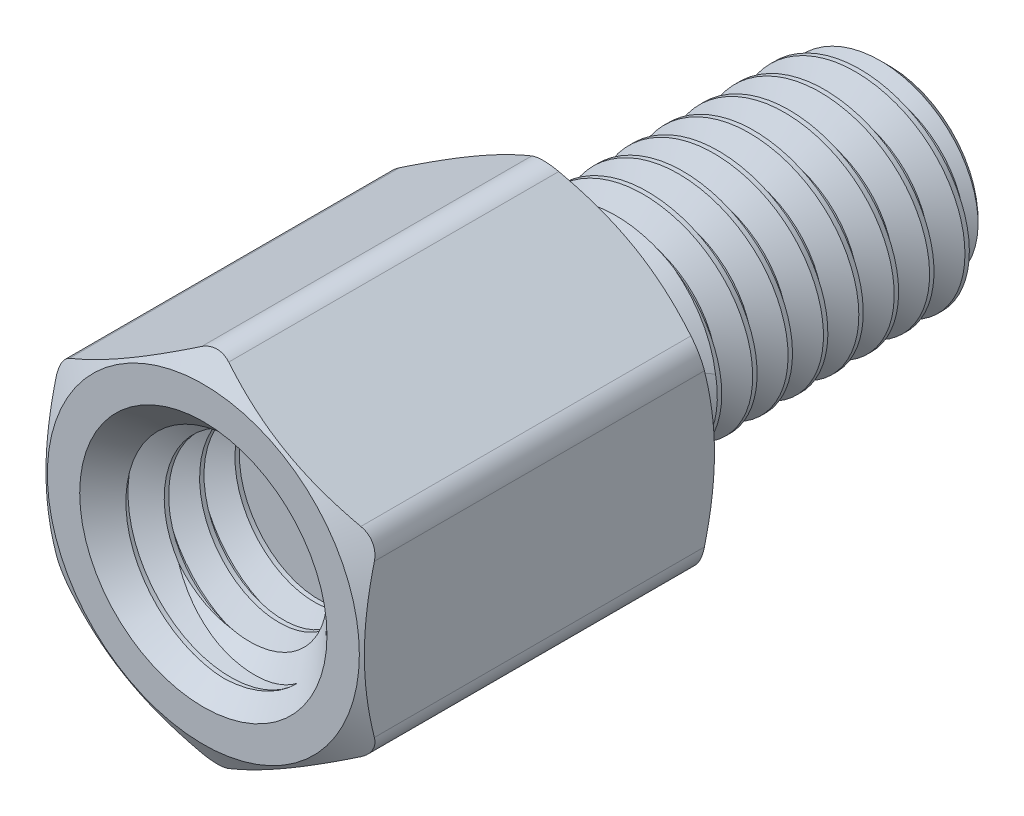
from build123d import *

# Parameters (mm, degrees)
SKETCH4_R           = 1.875
BOSS_EXTRUDE1_DEPTH = 5
SKETCH5_OUTSIDE_W   = 47.99
SKETCH5_OUTSIDE_H   = 48.686
SKETCH5_OUTSIDE_R   = 2.205
CUT_EXTRUDE1_DEPTH  = 11.290894033
CUT_EXTRUDE1_DRAFT  = -60
SKETCH6_OUTSIDE_W   = 33.36
SKETCH6_OUTSIDE_H   = 34.056
SKETCH6_OUTSIDE_R   = 2.205
CUT_EXTRUDE2_DEPTH  = 7.06733055
CUT_EXTRUDE2_DRAFT  = -60
FILLET1_R           = 0.3825
CUT_SWEEP1_PITCH    = 0.5
SKETCH9_R           = 1.75
BOSS_EXTRUDE2_DEPTH = 1.8
SKETCH10_W          = 1.8
SKETCH10_H          = 1.5
CUT_SWEEP2_PITCH    = 0.5


with BuildPart() as part:
    # Sketch3 → Revolve1 (revolve)
    with BuildSketch(Plane(origin=(0, 0, 0), x_dir=(0, 0, -1), z_dir=(1, 0, 0))):
        with BuildLine():
            Line((-3.2, 1.25), (-3.2, 0))
            Line((-3.2, 0), (4.7, 0))
            Line((4.7, 0), (4.7, 1.25))
            Line((4.7, 1.25), (4.45, 1.5))
            Line((4.45, 1.5), (0.7515, 1.5))
            Line((0.7515, 1.5), (0.564, 1.175240474))
            Line((0.564, 1.175240474), (0.25, 1.175240474))
            ThreePointArc((0.25, 1.175240474), (0.073223305, 1.248463778), (0, 1.425240474))
            Line((0, 1.425240474), (0, 2.25))
            Line((0, 2.25), (-5, 2.25))
            Line((-5, 2.25), (-5, 1.75))
            Line((-5, 1.75), (-4.75, 1.5))
            Line((-4.75, 1.5), (-3.45, 1.5))
            Line((-3.45, 1.5), (-3.2, 1.25))
        make_face()
    revolve(axis=Axis((0, 0, -4.7), (0, 0, 1)))

    # Sketch4 → Boss-Extrude1 (add)
    with BuildSketch(Plane.XY.offset(5)):
        Polygon((-2.25, 1.299038106), (-2.25, -1.299038106), (0, -2.598076211), (2.25, -1.299038106), (2.25, 1.299038106), (0, 2.598076211), align=None)
        Circle(SKETCH4_R, mode=Mode.SUBTRACT)
    extrude(amount=-BOSS_EXTRUDE1_DEPTH)


with BuildPart() as cut_extrude1_tool:
    # Sketch5 outside → Cut-Extrude1 (with draft: the straight prism first)
    with BuildSketch(Plane.XY.offset(5)):
        Rectangle(SKETCH5_OUTSIDE_W, SKETCH5_OUTSIDE_H)
        Circle(SKETCH5_OUTSIDE_R, mode=Mode.SUBTRACT)
    extrude(amount=-CUT_EXTRUDE1_DEPTH)
    # Cut-Extrude1: the draft: its side faces are tilted about the plane it starts from
    cut_extrude1_sides = [cut_extrude1_tool.faces().sort_by_distance(p)[0] for p in [
        (0, -24.343, -0.645447017),
        (23.995, 0, -0.645447017),
        (0, 24.343, -0.645447017),
        (-23.995, 0, -0.645447017),
        (-2.205, 0, -0.645447017),
    ]]
    draft(cut_extrude1_sides, Plane.XY.offset(5), CUT_EXTRUDE1_DRAFT)


with BuildPart() as part_1:
    add(part.part)

    # Cut-Extrude1: cut by cut_extrude1_tool
    add(cut_extrude1_tool.part, mode=Mode.SUBTRACT)


with BuildPart() as cut_extrude2_tool:
    # Sketch6 outside → Cut-Extrude2 (with draft: the straight prism first)
    with BuildSketch(Plane(origin=(0, 0, 0), x_dir=(-1, 0, 0), z_dir=(0, 0, -1))):
        Rectangle(SKETCH6_OUTSIDE_W, SKETCH6_OUTSIDE_H)
        Circle(SKETCH6_OUTSIDE_R, mode=Mode.SUBTRACT)
    extrude(amount=-CUT_EXTRUDE2_DEPTH)
    # Cut-Extrude2: the draft: its side faces are tilted about the plane it starts from
    cut_extrude2_sides = [cut_extrude2_tool.faces().sort_by_distance(p)[0] for p in [
        (0, -17.028, 3.533665275),
        (-16.68, 0, 3.533665275),
        (0, 17.028, 3.533665275),
        (16.68, 0, 3.533665275),
        (2.205, 0, 3.533665275),
    ]]
    draft(cut_extrude2_sides, Plane(origin=(0, 0, 0), x_dir=(-1, 0, 0), z_dir=(0, 0, -1)), CUT_EXTRUDE2_DRAFT)


with BuildPart() as part_2:
    add(part_1.part)

    # Cut-Extrude2: cut by cut_extrude2_tool
    add(cut_extrude2_tool.part, mode=Mode.SUBTRACT)

    # Fillet1
    fillet1_edges = [part_2.edges().sort_by_distance(p)[0] for p in [
        (0, 2.598076211, 2.5),
        (-2.25, -1.299038106, 2.5),
        (0, -2.598076211, 2.5),
        (2.25, -1.299038106, 2.5),
        (2.25, 1.299038106, 2.5),
        (-2.25, 1.299038106, 2.5),
    ]]
    fillet(fillet1_edges, radius=FILLET1_R)

    # Cut-Sweep1: the profile of Sketch7 profile screwed along a right-hand helix of 9.118 turns, 6 arcs to a turn; built about Z, then put on its axis
    cut_sweep1_z = Axis((0, 0, 0), (0, 0, 1))
    cut_sweep1_corners = [(1.174940474, 0, -0.187673205), (1.174940474, 0, -0.249826795), (1.527063294, 0, -0.453125), (1.527063294, 0, 0.015625)]
    with BuildLine(mode=Mode.PRIVATE) as cut_sweep1_profile:
        Line(cut_sweep1_corners[0], cut_sweep1_corners[1])
        Line(cut_sweep1_corners[1], cut_sweep1_corners[2])
        Line(cut_sweep1_corners[2], cut_sweep1_corners[3])
        Line(cut_sweep1_corners[3], cut_sweep1_corners[0])
    cut_sweep1_cap = Face(cut_sweep1_profile.wire())
    cut_sweep1_turn_angles = [0, 30, 60, 90, 120, 150, 180, 210, 240, 270, 300, 330, 360]
    cut_sweep1_turn_weights = [1, 0.8660254037844387, 1, 0.8660254037844387, 1, 0.8660254037844387, 1, 0.8660254037844387, 1, 0.8660254037844387, 1, 0.8660254037844387, 1]
    cut_sweep1_turn_rails = [Edge.make_bspline([Vector(p[0], p[1], 0).rotate(cut_sweep1_z, cut_sweep1_turn_angles[k]) / cut_sweep1_turn_weights[k] + Vector(0, 0, p[2] + CUT_SWEEP1_PITCH * cut_sweep1_turn_angles[k] / 360) for k in range(13)], [0, 0, 0, 1, 1, 2, 2, 3, 3, 4, 4, 5, 5, 6, 6, 6], 2, cut_sweep1_turn_weights) for p in cut_sweep1_corners]
    cut_sweep1_turn_sides = [Face.make_surface_from_curves(cut_sweep1_turn_rails[p[0]], cut_sweep1_turn_rails[p[1]]) for p in [(0, 1), (1, 2), (2, 3), (3, 0)]]
    cut_sweep1_last_angles = [3240, 3261.24, 3282.48]
    cut_sweep1_last_weights = [1, 0.9320711124581922, 1]
    cut_sweep1_last_rails = [Edge.make_bspline([Vector(p[0], p[1], 0).rotate(cut_sweep1_z, cut_sweep1_last_angles[k]) / cut_sweep1_last_weights[k] + Vector(0, 0, p[2] + CUT_SWEEP1_PITCH * cut_sweep1_last_angles[k] / 360) for k in range(3)], [0, 0, 0, 1, 1, 1], 2, cut_sweep1_last_weights) for p in cut_sweep1_corners]
    cut_sweep1_last_sides = [Face.make_surface_from_curves(cut_sweep1_last_rails[p[0]], cut_sweep1_last_rails[p[1]]) for p in [(0, 1), (1, 2), (2, 3), (3, 0)]]
    cut_sweep1 = Plane(origin=(0, 0, -4.7), x_dir=(0, 1, 0), z_dir=(0, 0, 1)) * Solid(Shell([*[p.moved(Location((0, 0, CUT_SWEEP1_PITCH * i))) for i in range(9) for p in cut_sweep1_turn_sides], *cut_sweep1_last_sides, cut_sweep1_cap, cut_sweep1_cap.rotate(cut_sweep1_z, 3282.48).moved(Location((0, 0, CUT_SWEEP1_PITCH * 3282.48 / 360)))]))
    add(cut_sweep1, mode=Mode.SUBTRACT)

    # Sketch9 → Boss-Extrude2 (add)
    with BuildSketch(Plane.XY.offset(3.2)):
        Circle(SKETCH9_R)
    extrude(amount=BOSS_EXTRUDE2_DEPTH)


with BuildPart() as body_2:
    # Sketch10 → Revolve2 (revolve)
    with BuildSketch(Plane(origin=(0, 0, 0), x_dir=(0, 0, -1), z_dir=(1, 0, 0))):
        with Locations((-4.1, 0.75)):
            Rectangle(SKETCH10_W, SKETCH10_H)
    revolve(axis=Axis((0, 0, -4.7), (0, 0, 1)))

    # Cut-Sweep2: the profile of Sketch12 profile screwed along a right-hand helix of 4.6 turns, 6 arcs to a turn; built about Z, then put on its axis
    cut_sweep2_z = Axis((0, 0, 0), (0, 0, 1))
    cut_sweep2_corners = [(1.174940474, 0, -0.249826795), (1.174940474, 0, -0.187673205), (1.527063294, 0, 0.015625), (1.527063294, 0, -0.453125)]
    with BuildLine(mode=Mode.PRIVATE) as cut_sweep2_profile:
        Line(cut_sweep2_corners[0], cut_sweep2_corners[1])
        Line(cut_sweep2_corners[1], cut_sweep2_corners[2])
        Line(cut_sweep2_corners[2], cut_sweep2_corners[3])
        Line(cut_sweep2_corners[3], cut_sweep2_corners[0])
    cut_sweep2_cap = Face(cut_sweep2_profile.wire())
    cut_sweep2_turn_angles = [0, 30, 60, 90, 120, 150, 180, 210, 240, 270, 300, 330, 360]
    cut_sweep2_turn_weights = [1, 0.8660254037844387, 1, 0.8660254037844387, 1, 0.8660254037844387, 1, 0.8660254037844387, 1, 0.8660254037844387, 1, 0.8660254037844387, 1]
    cut_sweep2_turn_rails = [Edge.make_bspline([Vector(p[0], p[1], 0).rotate(cut_sweep2_z, cut_sweep2_turn_angles[k]) / cut_sweep2_turn_weights[k] + Vector(0, 0, p[2] + CUT_SWEEP2_PITCH * cut_sweep2_turn_angles[k] / 360) for k in range(13)], [0, 0, 0, 1, 1, 2, 2, 3, 3, 4, 4, 5, 5, 6, 6, 6], 2, cut_sweep2_turn_weights) for p in cut_sweep2_corners]
    cut_sweep2_turn_sides = [Face.make_surface_from_curves(cut_sweep2_turn_rails[p[0]], cut_sweep2_turn_rails[p[1]]) for p in [(0, 1), (1, 2), (2, 3), (3, 0)]]
    cut_sweep2_last_angles = [1440, 1470, 1500, 1530, 1560, 1590, 1620, 1638, 1656]
    cut_sweep2_last_weights = [1, 0.8660254037844387, 1, 0.8660254037844387, 1, 0.8660254037844387, 1, 0.9510565162951511, 1]
    cut_sweep2_last_rails = [Edge.make_bspline([Vector(p[0], p[1], 0).rotate(cut_sweep2_z, cut_sweep2_last_angles[k]) / cut_sweep2_last_weights[k] + Vector(0, 0, p[2] + CUT_SWEEP2_PITCH * cut_sweep2_last_angles[k] / 360) for k in range(9)], [0, 0, 0, 1, 1, 2, 2, 3, 3, 4, 4, 4], 2, cut_sweep2_last_weights) for p in cut_sweep2_corners]
    cut_sweep2_last_sides = [Face.make_surface_from_curves(cut_sweep2_last_rails[p[0]], cut_sweep2_last_rails[p[1]]) for p in [(0, 1), (1, 2), (2, 3), (3, 0)]]
    cut_sweep2 = Plane(origin=(0, 0, 5), x_dir=(0, 1, 0), z_dir=(0, 0, -1)) * Solid(Shell([*[p.moved(Location((0, 0, CUT_SWEEP2_PITCH * i))) for i in range(4) for p in cut_sweep2_turn_sides], *cut_sweep2_last_sides, cut_sweep2_cap, cut_sweep2_cap.rotate(cut_sweep2_z, 1656).moved(Location((0, 0, CUT_SWEEP2_PITCH * 1656 / 360)))]))
    add(cut_sweep2, mode=Mode.SUBTRACT)


with BuildPart() as part_3:
    add(part_2.part)

    # Combine1: cut body 2
    add(body_2.part, mode=Mode.SUBTRACT)

    # Cut-Extrude3 cone 1 section (through the dimple's axis) → Cut-Extrude3 (revolve, cut)
    with BuildSketch(Plane(origin=(0, 0, 5), x_dir=(0, -1, 0), z_dir=(1, 0, 0))):
        Polygon((0, 0), (1.7475, 0), (0, 1.7475), align=None)
    revolve(axis=Axis((0, 0, 5), (0, 0, -1)), mode=Mode.SUBTRACT)


solid = part_3.part
